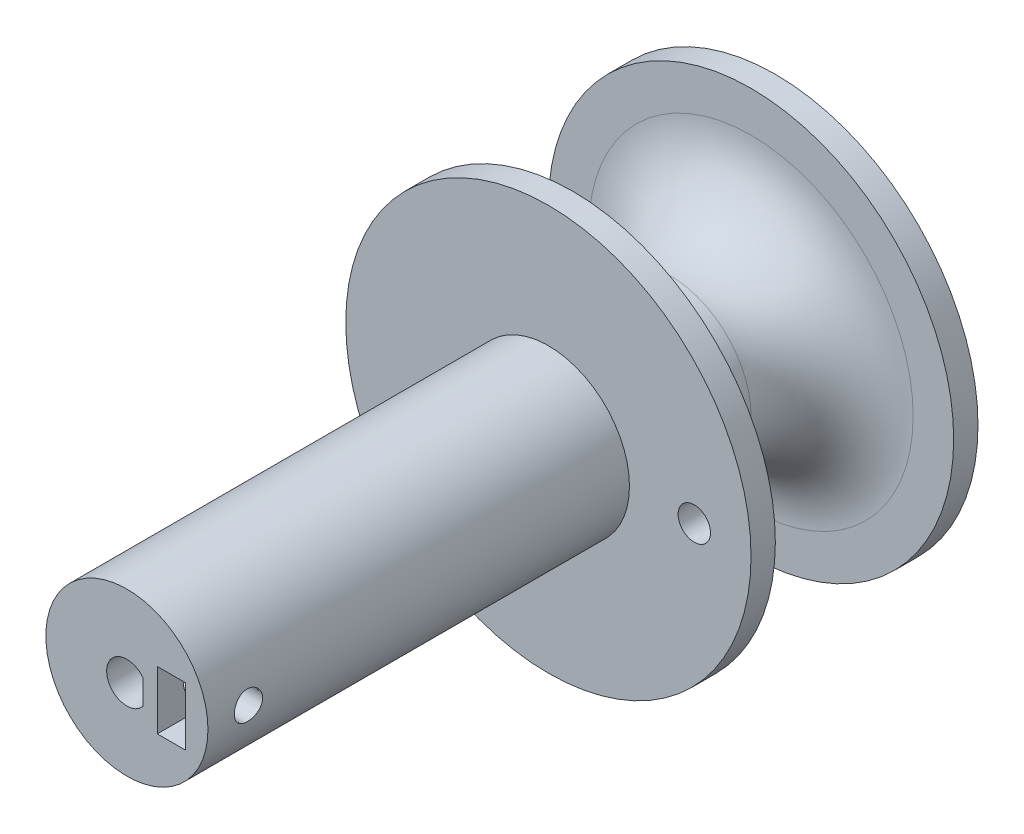
from build123d import *

# Parameters (mm, degrees)
CROQUIS1_R              = 10
SALIENTE_EXTRUIR2_DEPTH = 80
CROQUIS4_R              = 25
SALIENTE_EXTRUIR3_DEPTH = 3
SALIENTE_EXTRUIR4_START = 25
CROQUIS5_R              = 25
SALIENTE_EXTRUIR4_DEPTH = 3
REDONDEO2_R             = 10
CORTAR_EXTRUIR1_START   = 80
CORTAR_EXTRUIR1_DEPTH   = 20
CORTAR_EXTRUIR2_START   = 80
CROQUIS7_W              = 3.5
CROQUIS7_H              = 7.2
CORTAR_EXTRUIR2_DEPTH   = 10
CORTAR_EXTRUIR3_START   = 1.785357468
CORTAR_EXTRUIR3_DEPTH   = 8.214642632
CORTAR_EXTRUIR4_START   = 24.165153
CROQUIS9_R              = 2
CORTAR_EXTRUIR4_DEPTH   = 3.834847


# Read off the part's stored shape, not the designer's step: Cortar-Extruir3
with BuildPart() as part:
    # Croquis1 → Saliente-Extruir2 (new body)
    with BuildSketch(Plane.XY):
        Circle(CROQUIS1_R)
    extrude(amount=SALIENTE_EXTRUIR2_DEPTH)

    # Croquis4 → Saliente-Extruir3 (add)
    with BuildSketch(Plane.XY):
        Circle(CROQUIS4_R)
    extrude(amount=SALIENTE_EXTRUIR3_DEPTH)

    # Croquis5 → Saliente-Extruir4 (add)
    with BuildSketch(Plane.XY.offset(SALIENTE_EXTRUIR4_START)):
        Circle(CROQUIS5_R)
    extrude(amount=SALIENTE_EXTRUIR4_DEPTH)

    # Redondeo2
    redondeo2_edges = [part.edges().sort_by_distance(p)[0] for p in [
        (-10, 0, 25),
        (-10, 0, 3),
    ]]
    fillet(redondeo2_edges, radius=REDONDEO2_R)

    # Croquis6 → Cortar-Extruir1 (cut)
    with BuildSketch(Plane.XY.offset(CORTAR_EXTRUIR1_START)):
        with BuildLine():
            Line((2, 1.5), (2, -1.5))
            ThreePointArc((2, -1.5), (-2.5, 0), (2, 1.5))
        make_face()
    extrude(amount=-CORTAR_EXTRUIR1_DEPTH, mode=Mode.SUBTRACT)

    # Croquis7 → Cortar-Extruir2 (cut)
    with BuildSketch(Plane.XY.offset(CORTAR_EXTRUIR2_START)):
        with Locations((5.5, 0)):
            Rectangle(CROQUIS7_W, CROQUIS7_H)
    extrude(amount=-CORTAR_EXTRUIR2_DEPTH, mode=Mode.SUBTRACT)

    # Cortar-Extruir3 outline → Cortar-Extruir3 (cut)
    with BuildSketch(Plane(origin=(0, 0, 0), x_dir=(0, 0, -1), z_dir=(1, 0, 0)).offset(CORTAR_EXTRUIR3_START)):
        with BuildLine():
            add(Edge.make_bspline(
                [(-73.250000008, 0), (-73.250010298, 0.457042806), (-73.439269311, 0.913556657), (-73.761440573, 1.236313288), (-74.083774062, 1.559232356), (-74.536167707, 1.749638189), (-74.998632957, 1.749999466), (-75.46109828, 1.75036072), (-75.914256207, 1.560125437), (-76.558728463, 0.916635921), (-76.75, 0.463408547), (-76.75, -0.463408547), (-76.559497121, -0.915462775), (-75.915045576, -1.559741953), (-75.458501248, -1.749734355), (-74.543528816, -1.750265056), (-74.088756627, -1.563446648), (-73.437067231, -0.912124478), (-73.250180582, -0.457964068), (-73.250000045, -0.000460382), (-73.250000003, -0.000230191), (-73.250000008, 0)],
                knots=[0.500062925, 0.500062925, 0.500062925, 0.500062925, 0.625, 0.625, 0.625000034, 0.750000005, 0.750000005, 0.750000019, 0.875000002, 0.875000002, 0.999999997, 0.999999997, 1.124999993, 1.124999993, 1.24999999, 1.24999999, 1.374999987, 1.374999987, 1.499999981, 1.499999981, 1.500062906, 1.500062906, 1.500062906, 1.500062906], degree=3))
        make_face()
    extrude(amount=CORTAR_EXTRUIR3_DEPTH, mode=Mode.SUBTRACT)

    # Croquis9 → Cortar-Extruir4 (cut)
    with BuildSketch(Plane.XY.offset(CORTAR_EXTRUIR4_START)):
        with Locations((18, 0)):
            Circle(CROQUIS9_R)
    extrude(amount=CORTAR_EXTRUIR4_DEPTH, mode=Mode.SUBTRACT)


solid = part.part
